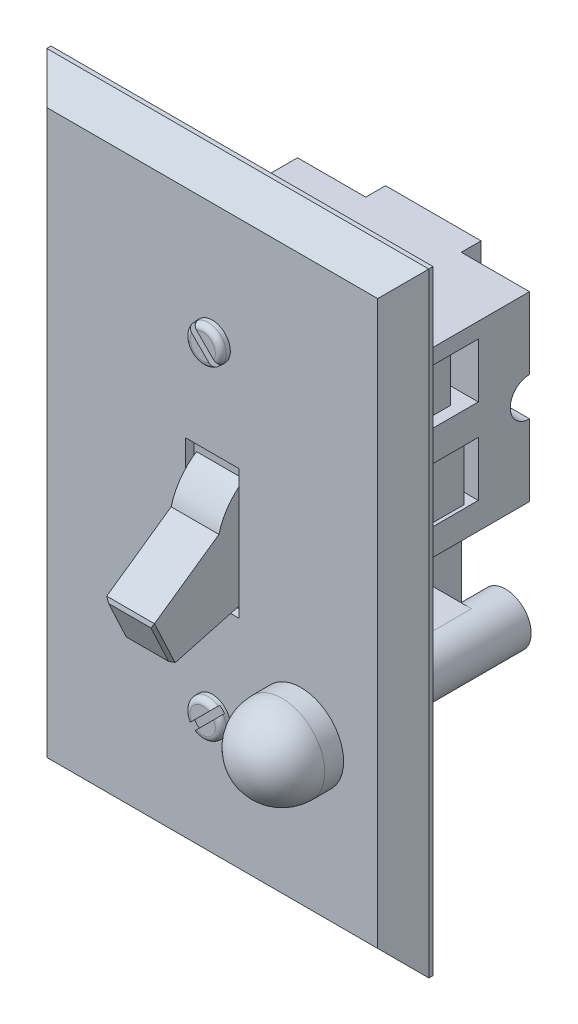
from build123d import *
from OCP.BRepFilletAPI import BRepFilletAPI_MakeChamfer

# Parameters (mm, degrees)
SKETCH1_W                 = 43.18
SKETCH1_H                 = 60.325
BOSS_EXTRUDE1_DEPTH       = 38.1
CUT_EXTRUDE1_DEPTH        = 54.174378287
CUT_EXTRUDE1_DEPTH_BACK   = 54.174378287
CUT_EXTRUDE2_DEPTH        = 12.7
CUT_EXTRUDE3_START        = -12.7
CUT_EXTRUDE3_DEPTH        = 12.7
CUT_EXTRUDE4_DEPTH        = 12.7
CUT_EXTRUDE5_DEPTH        = 15.875
CUT_EXTRUDE6_DEPTH        = 62.633906012
CUT_EXTRUDE6_DEPTH_BACK   = 62.633906012
SKETCH8_W                 = 3.81
SKETCH8_H                 = 2.8575
CUT_EXTRUDE7_DEPTH        = 44.241821553
SKETCH9_W                 = 12.7
SKETCH9_H                 = 14.478
CUT_EXTRUDE8_DEPTH        = 61.592610368
SKETCH10_W                = 12.7
SKETCH10_H                = 41.5925
CUT_EXTRUDE9_DEPTH        = 15.875
SKETCH11_W                = 3.175
SKETCH11_H                = 10.16
CUT_EXTRUDE10_DEPTH       = 12.7
SKETCH13_W                = 9.017
SKETCH13_H                = 10.16
SKETCH13_H_2              = 12.065
CUT_EXTRUDE11_DEPTH       = 2.032
CUT_EXTRUDE12_DEPTH       = 12.7
SKETCH15_R                = 2.413
BOSS_EXTRUDE2_DEPTH       = 1.524
SKETCH16_W                = 1.524
SKETCH16_H                = 9.906
BOSS_EXTRUDE3_DEPTH       = 6.858
SKETCH19_W                = 10.668
SKETCH19_H                = 13.589
BOSS_EXTRUDE5_DEPTH       = 1.524
SKETCH20_W                = 1.524
SKETCH20_H                = 12.065
BOSS_EXTRUDE6_DEPTH       = 6.858
SKETCH17_R                = 4.1275
BOSS_EXTRUDE4_DEPTH       = 2.54
FILLET1_R                 = 1.524
CUT_EXTRUDE13_DEPTH       = 1.27
CUT_EXTRUDE14_DEPTH       = 4.7625
CUT_EXTRUDE15_DEPTH       = 1.524
DELETEFACE2_START         = -8.89
DELETEFACE2_DEPTH         = 17.78
SKETCH23_R                = 1.7526
BOSS_EXTRUDE8_DEPTH       = 3.048
CUT_EXTRUDE16_DEPTH       = 70.14216971
CUT_EXTRUDE16_DEPTH_BACK  = 70.14216971
BOSS_EXTRUDE9_DEPTH       = 4.445
CHAMFER1_SIZE             = 0.508
CHAMFER1_SIZE2            = 0.62626395
BODY_MOVE_COPY1_ANGLE     = 25
BOSS_EXTRUDE10_DEPTH      = 1.524
BOSS_EXTRUDE10_DEPTH_BACK = 4.0259
SKETCH26_W                = 71.12
SKETCH26_H                = 114.3
CHAMFER2_SIZE             = 4.7625
SHELL1_T                  = -1.524
SKETCH27_R                = 6.731
SKETCH27_W                = 9.906
SKETCH27_H                = 24.13
CUT_EXTRUDE17_DEPTH       = 1.524
SKETCH28_R                = 3.3655
BOSS_EXTRUDE11_DEPTH      = 1.778
FILLET2_R                 = 1.016
CUT_EXTRUDE18_DEPTH       = 1.27
SKETCH31_R                = 4.7625
BOSS_EXTRUDE12_DEPTH      = 38.1
BOSS_EXTRUDE13_START      = -19.05
SKETCH32_W                = 7.62
SKETCH32_H                = 9.525
BOSS_EXTRUDE13_DEPTH      = 12.7


# Read off the part's stored shape, not the designer's step: DeleteFace2
with BuildPart() as part:
    # Sketch1 → Boss-Extrude1 (new body)
    with BuildSketch(Plane.XY):
        Rectangle(SKETCH1_W, SKETCH1_H)
    extrude(amount=BOSS_EXTRUDE1_DEPTH)

    # Sketch2 → Cut-Extrude1 (cut, two sides: drawn at the far end of the back side and taken through both)
    with BuildSketch(Plane(origin=(0, 0, 0), x_dir=(0, 0, -1), z_dir=(1, 0, 0)).offset(-CUT_EXTRUDE1_DEPTH_BACK)):
        Polygon((0, 0), (-3.683, -3.683), (-3.683, -30.1625), (0, -30.1625), align=None)
    extrude(amount=CUT_EXTRUDE1_DEPTH + CUT_EXTRUDE1_DEPTH_BACK, mode=Mode.SUBTRACT)

    # Sketch3 → Cut-Extrude2 (cut)
    with BuildSketch(Plane(origin=(21.59, 0, 0), x_dir=(0, 0, -1), z_dir=(1, 0, 0))):
        with BuildLine():
            Line((-3.683, 9.6647), (-3.683, -3.683))
            Line((-3.683, -3.683), (0, 0))
            Line((0, 0), (0, 30.1625))
            Line((0, 30.1625), (-3.683, 30.1625))
            Line((-3.683, 30.1625), (-3.683, 16.8148))
            ThreePointArc((-3.683, 16.8148), (-7.25805, 13.23975), (-3.683, 9.6647))
        make_face()
    extrude(amount=-CUT_EXTRUDE2_DEPTH, mode=Mode.SUBTRACT)

    # Sketch4 → Cut-Extrude3 (cut)
    with BuildSketch(Plane.ZY.offset(21.59).offset(CUT_EXTRUDE3_START)):
        with BuildLine():
            Line((3.683, -3.683), (3.683, 9.6647))
            ThreePointArc((3.683, 9.6647), (7.25805, 13.23975), (3.683, 16.8148))
            Line((3.683, 16.8148), (3.683, 30.1625))
            Line((3.683, 30.1625), (0, 30.1625))
            Line((0, 30.1625), (0, 0))
            Line((0, 0), (3.683, -3.683))
        make_face()
    extrude(amount=CUT_EXTRUDE3_DEPTH, mode=Mode.SUBTRACT)

    # Sketch5 → Cut-Extrude4 (cut)
    with BuildSketch(Plane(origin=(21.59, 0, 0), x_dir=(0, 0, -1), z_dir=(1, 0, 0))):
        with BuildLine():
            Line((-38.1, -13.208), (-26.9875, -13.208))
            ThreePointArc((-26.9875, -13.208), (-23.619903955, -11.813096045), (-22.225, -8.4455))
            Line((-22.225, -8.4455), (-22.225, -3.683))
            Line((-22.225, -3.683), (-3.683, -3.683))
            Line((-3.683, -3.683), (-3.683, -30.1625))
            Line((-3.683, -30.1625), (-38.1, -30.1625))
            Line((-38.1, -30.1625), (-38.1, -13.208))
        make_face()
    extrude(amount=-CUT_EXTRUDE4_DEPTH, mode=Mode.SUBTRACT)

    # Sketch6 → Cut-Extrude5 (cut)
    with BuildSketch(Plane.XY.offset(38.1)):
        with BuildLine():
            Line((13.97, 27.305), (21.59, 27.305))
            Line((21.59, 27.305), (21.59, 17.145))
            Line((21.59, 17.145), (13.97, 17.145))
            ThreePointArc((13.97, 17.145), (8.89, 22.225), (13.97, 27.305))
        make_face()
        with BuildLine():
            Line((13.97, 11.43), (21.59, 11.43))
            Line((21.59, 11.43), (21.59, 1.27))
            Line((21.59, 1.27), (13.97, 1.27))
            ThreePointArc((13.97, 1.27), (8.89, 6.35), (13.97, 11.43))
        make_face()
        with BuildLine():
            Line((-13.97, 1.27), (-21.59, 1.27))
            Line((-21.59, 1.27), (-21.59, 11.43))
            Line((-21.59, 11.43), (-13.97, 11.43))
            ThreePointArc((-13.97, 11.43), (-8.89, 6.35), (-13.97, 1.27))
        make_face()
        with BuildLine():
            Line((-13.97, 17.145), (-21.59, 17.145))
            Line((-21.59, 17.145), (-21.59, 27.305))
            Line((-21.59, 27.305), (-13.97, 27.305))
            ThreePointArc((-13.97, 27.305), (-8.89, 22.225), (-13.97, 17.145))
        make_face()
    extrude(amount=-CUT_EXTRUDE5_DEPTH, mode=Mode.SUBTRACT)

    # Sketch7 → Cut-Extrude6 (cut, two sides: drawn at the far end of the back side and taken through both)
    with BuildSketch(Plane.XZ.offset(13.208).offset(-CUT_EXTRUDE6_DEPTH_BACK)):
        with BuildLine():
            Line((14.605, 38.1), (14.605, 34.925))
            Line((14.605, 34.925), (17.78, 34.925))
            ThreePointArc((17.78, 34.925), (20.474076836, 33.809076836), (21.59, 31.115))
            Line((21.59, 31.115), (21.59, 38.1))
            Line((21.59, 38.1), (14.605, 38.1))
        make_face()
        with BuildLine():
            Line((-14.605, 34.925), (-17.78, 34.925))
            ThreePointArc((-17.78, 34.925), (-20.474076836, 33.809076836), (-21.59, 31.115))
            Line((-21.59, 31.115), (-21.59, 38.1))
            Line((-21.59, 38.1), (-14.605, 38.1))
            Line((-14.605, 38.1), (-14.605, 34.925))
        make_face()
    extrude(amount=CUT_EXTRUDE6_DEPTH + CUT_EXTRUDE6_DEPTH_BACK, mode=Mode.SUBTRACT)

    # Sketch8 → Cut-Extrude7 (cut, through all)
    with BuildSketch(Plane.XY.offset(22.225)):
        with Locations((-19.685, 28.73375)):
            Rectangle(SKETCH8_W, SKETCH8_H)
        with Locations((19.685, 28.73375)):
            Rectangle(SKETCH8_W, SKETCH8_H)
    extrude(amount=CUT_EXTRUDE7_DEPTH, mode=Mode.SUBTRACT)

    # Sketch9 → Cut-Extrude8 (cut, through all)
    with BuildSketch(Plane(origin=(14.605, 0, 0), x_dir=(0, 0, -1), z_dir=(1, 0, 0))):
        with Locations((-28.575, -5.969)):
            Rectangle(SKETCH9_W, SKETCH9_H)
    extrude(amount=CUT_EXTRUDE8_DEPTH, mode=Mode.SUBTRACT)

    # Sketch10 → Cut-Extrude9 (cut)
    with BuildSketch(Plane.XY.offset(38.1)):
        with Locations((-15.24, -9.36625)):
            Rectangle(SKETCH10_W, SKETCH10_H)
    extrude(amount=-CUT_EXTRUDE9_DEPTH, mode=Mode.SUBTRACT)

    # Sketch11 → Cut-Extrude10 (cut)
    with BuildSketch(Plane.ZY.offset(21.59)):
        with Locations((14.7955, 22.225)):
            Rectangle(SKETCH11_W, SKETCH11_H)
        with Locations((14.7955, 6.35)):
            Rectangle(SKETCH11_W, SKETCH11_H)
        with Locations((23.8125, 22.225)):
            Rectangle(SKETCH11_W, SKETCH11_H)
        with Locations((23.8125, 6.35)):
            Rectangle(SKETCH11_W, SKETCH11_H)
    cut_extrude10 = extrude(amount=-CUT_EXTRUDE10_DEPTH, mode=Mode.SUBTRACT)

    # Sketch13 → Cut-Extrude11 (cut)
    with BuildSketch(Plane.ZY.offset(21.59)):
        with Locations((20.8915, 22.225)):
            Rectangle(SKETCH13_W, SKETCH13_H)
        with Locations((20.8915, 6.35)):
            Rectangle(SKETCH13_W, SKETCH13_H)
        with Locations((17.7165, -24.13)):
            Rectangle(SKETCH13_W, SKETCH13_H_2)
    cut_extrude11 = extrude(amount=-CUT_EXTRUDE11_DEPTH, mode=Mode.SUBTRACT)

    # Sketch14 → Cut-Extrude12 (cut)
    with BuildSketch(Plane.ZY.offset(21.59)):
        Polygon((22.225, -1.27), (13.208, -1.27), (13.208, -15.5575), (16.383, -15.5575), (17.145, -10.16), (22.225, -10.16), align=None)
    extrude(amount=-CUT_EXTRUDE12_DEPTH, mode=Mode.SUBTRACT)

    # Sketch15 → Boss-Extrude2 (add)
    with BuildSketch(Plane.XY.offset(22.225)):
        with BuildLine():
            Line((-15.24, 1.397), (-21.082, 1.397))
            Line((-21.082, 1.397), (-21.082, 11.303))
            Line((-21.082, 11.303), (-15.24, 11.303))
            ThreePointArc((-15.24, 11.303), (-10.287, 6.35), (-15.24, 1.397))
        make_face()
        with Locations((-15.24, 6.35)):
            Circle(SKETCH15_R, mode=Mode.SUBTRACT)
    boss_extrude2 = extrude(amount=BOSS_EXTRUDE2_DEPTH)

    # Sketch16 → Boss-Extrude3 (add)
    with BuildSketch(Plane(origin=(0, 0, 22.225), x_dir=(-1, 0, 0), z_dir=(0, 0, -1))):
        with Locations((20.32, 6.35)):
            Rectangle(SKETCH16_W, SKETCH16_H)
    boss_extrude3 = extrude(amount=BOSS_EXTRUDE3_DEPTH)

    # Mirror1: Cut-Extrude10, Cut-Extrude11, Boss-Extrude2, Boss-Extrude3 across plane
    add(cut_extrude10.mirror(Plane(origin=(0, 0, 0), x_dir=(0, 0, 1), z_dir=(1, 0, 0))), mode=Mode.SUBTRACT)
    add(cut_extrude11.mirror(Plane(origin=(0, 0, 0), x_dir=(0, 0, 1), z_dir=(1, 0, 0))), mode=Mode.SUBTRACT)
    add(boss_extrude2.mirror(Plane(origin=(0, 0, 0), x_dir=(0, 0, 1), z_dir=(1, 0, 0))))
    add(boss_extrude3.mirror(Plane(origin=(0, 0, 0), x_dir=(0, 0, 1), z_dir=(1, 0, 0))))

    # Sketch19 → Boss-Extrude5 (add)
    with BuildSketch(Plane.XY.offset(22.225)):
        with Locations((-15.748, -23.368)):
            Rectangle(SKETCH19_W, SKETCH19_H)
    extrude(amount=BOSS_EXTRUDE5_DEPTH)

    # Sketch20 → Boss-Extrude6 (add)
    with BuildSketch(Plane(origin=(0, 0, 22.225), x_dir=(-1, 0, 0), z_dir=(0, 0, -1))):
        with Locations((20.32, -24.13)):
            Rectangle(SKETCH20_W, SKETCH20_H)
    extrude(amount=BOSS_EXTRUDE6_DEPTH)

    # Sketch17 → Boss-Extrude4 (add)
    with BuildSketch(Plane.XY.offset(23.749)):
        with Locations((15.24, 6.35)):
            Circle(SKETCH17_R)
        with Locations((-15.748, -25.4635)):
            Circle(SKETCH17_R)
    extrude(amount=BOSS_EXTRUDE4_DEPTH)

    # Fillet1
    fillet1_edges = [part.edges().sort_by_distance(p)[0] for p in [
        (11.1125, 6.35, 26.289),
        (-19.8755, -25.4635, 26.289),
    ]]
    fillet(fillet1_edges, radius=FILLET1_R)

    # Sketch18 → Cut-Extrude13 (cut)
    with BuildSketch(Plane.XY.offset(26.289)):
        Polygon((11.872403955, 8.819570433), (12.770429567, 9.717596045), (18.607596045, 3.880429567), (17.709570433, 2.982403955), align=None)
        Polygon((-18.217570433, -22.095903955), (-19.115596045, -22.993929567), (-13.278429567, -28.831096045), (-12.380403955, -27.933070433), align=None)
    extrude(amount=-CUT_EXTRUDE13_DEPTH, mode=Mode.SUBTRACT)

    # Sketch21 → Cut-Extrude14 (cut, symmetric)
    with BuildSketch(Plane(origin=(0, 0, 0), x_dir=(0, 0, -1), z_dir=(1, 0, 0))):
        Polygon((-38.1, 30.1625), (-38.1, 10.16), (-36.576, 11.03988181), (-36.576, 30.1625), align=None)
        Polygon((-36.576, -30.1625), (-38.1, -30.1625), (-38.1, -10.16), (-36.576, -11.03988181), align=None)
    extrude(amount=CUT_EXTRUDE14_DEPTH, both=True, mode=Mode.SUBTRACT)

    # Sketch22 → Cut-Extrude15 (cut)
    with BuildSketch(Plane.XY.offset(38.1)):
        Polygon((-4.7625, -20.6375), (-8.89, -16.51), (-8.89, -11.03988181), (8.89, -11.03988181), (8.89, -16.51), (4.7625, -20.6375), align=None)
        Polygon((8.89, 16.51), (4.7625, 20.6375), (-4.7625, 20.6375), (-8.89, 16.51), (-8.89, 11.03988181), (8.89, 11.03988181), align=None)
    extrude(amount=-CUT_EXTRUDE15_DEPTH, mode=Mode.SUBTRACT)

    # DeleteFace2 outline → DeleteFace2 (cut)
    with BuildSketch(Plane.YZ.offset(DELETEFACE2_START)):
        Polygon((11.03988181, 38.1), (10.16, 38.1), (11.03988181, 36.576), align=None)
        Polygon((-11.03988181, 36.576), (-10.16, 38.1), (-11.03988181, 38.1), align=None)
    extrude(amount=DELETEFACE2_DEPTH, mode=Mode.SUBTRACT)



with BuildPart() as body_2:
    # Sketch23 → Boss-Extrude8 (new body)
    with BuildSketch(Plane.XY.offset(36.576)):
        with BuildLine():
            Line((-6.35, -52.3875), (-19.05, -52.3875))
            Line((-19.05, -52.3875), (-19.05, -47.8155))
            Line((-19.05, -47.8155), (-14.2875, -47.8155))
            ThreePointArc((-14.2875, -47.8155), (-12.5095, -46.0375), (-14.2875, -44.2595))
            Line((-14.2875, -44.2595), (-19.05, -44.2595))
            Line((-19.05, -44.2595), (-19.05, -39.6875))
            Line((-19.05, -39.6875), (-7.31887382, -39.6875))
            Line((-7.31887382, -39.6875), (-4.5085, -34.819789755))
            Line((-4.5085, -34.819789755), (-4.5085, -20.532289755))
            Line((-4.5085, -20.532289755), (-8.636, -16.404789755))
            Line((-8.636, -16.404789755), (-8.636, 16.404789755))
            Line((-8.636, 16.404789755), (-4.5085, 20.532289755))
            Line((-4.5085, 20.532289755), (-4.5085, 34.819789755))
            Line((-4.5085, 34.819789755), (-7.31887382, 39.6875))
            Line((-7.31887382, 39.6875), (-19.05, 39.6875))
            Line((-19.05, 39.6875), (-19.05, 44.2595))
            Line((-19.05, 44.2595), (-14.2875, 44.2595))
            ThreePointArc((-14.2875, 44.2595), (-12.5095, 46.0375), (-14.2875, 47.8155))
            Line((-14.2875, 47.8155), (-19.05, 47.8155))
            Line((-19.05, 47.8155), (-19.05, 52.3875))
            Line((-19.05, 52.3875), (-6.35, 52.3875))
            Line((-6.35, 52.3875), (-6.35, 46.0375))
            Line((-6.35, 46.0375), (6.35, 46.0375))
            Line((6.35, 46.0375), (6.35, 52.3875))
            Line((6.35, 52.3875), (19.05, 52.3875))
            Line((19.05, 52.3875), (19.05, 47.8155))
            Line((19.05, 47.8155), (14.2875, 47.8155))
            ThreePointArc((14.2875, 47.8155), (12.5095, 46.0375), (14.2875, 44.2595))
            Line((14.2875, 44.2595), (19.05, 44.2595))
            Line((19.05, 44.2595), (19.05, 39.6875))
            Line((19.05, 39.6875), (7.31887382, 39.6875))
            Line((7.31887382, 39.6875), (4.5085, 34.819789755))
            Line((4.5085, 34.819789755), (4.5085, 20.532289755))
            Line((4.5085, 20.532289755), (8.636, 16.404789755))
            Line((8.636, 16.404789755), (8.636, -16.404789755))
            Line((8.636, -16.404789755), (4.5085, -20.532289755))
            Line((4.5085, -20.532289755), (4.5085, -34.819789755))
            Line((4.5085, -34.819789755), (7.31887382, -39.6875))
            Line((7.31887382, -39.6875), (19.05, -39.6875))
            Line((19.05, -39.6875), (19.05, -44.2595))
            Line((19.05, -44.2595), (14.2875, -44.2595))
            ThreePointArc((14.2875, -44.2595), (12.5095, -46.0375), (14.2875, -47.8155))
            Line((14.2875, -47.8155), (19.05, -47.8155))
            Line((19.05, -47.8155), (19.05, -52.3875))
            Line((19.05, -52.3875), (6.35, -52.3875))
            Line((6.35, -52.3875), (6.35, -46.0375))
            Line((6.35, -46.0375), (-6.35, -46.0375))
            Line((-6.35, -46.0375), (-6.35, -52.3875))
        make_face()
        with Locations((0, 30.1625)):
            Circle(SKETCH23_R, mode=Mode.SUBTRACT)
        with Locations(Location((0, -30.1625, 0), (0, 0, 180))):
            Circle(SKETCH23_R, mode=Mode.SUBTRACT)
    extrude(amount=BOSS_EXTRUDE8_DEPTH)

    # Sketch24 → Cut-Extrude16 (cut, two sides: drawn at the far end of the back side and taken through both)
    with BuildSketch(Plane(origin=(0, 0, 0), x_dir=(0, 0, -1), z_dir=(1, 0, 0)).offset(-CUT_EXTRUDE16_DEPTH_BACK)):
        Polygon((-38.1, 52.3875), (-38.1, 39.6875), (-36.576, 34.819789755), (-36.576, 52.3875), align=None)
        Polygon((-39.624, 39.6875), (-38.1, 34.819789755), (-38.1, 11.91976362), (-39.624, 11.03988181), align=None)
        Polygon((-39.624, -11.03988181), (-39.624, -39.6875), (-38.1, -34.819789755), (-38.1, -11.91976362), align=None)
        Polygon((-36.576, -52.3875), (-38.1, -52.3875), (-38.1, -39.6875), (-36.576, -34.819789755), align=None)
    extrude(amount=CUT_EXTRUDE16_DEPTH + CUT_EXTRUDE16_DEPTH_BACK, mode=Mode.SUBTRACT)


with BuildPart() as body_3:
    # Sketch25 → Boss-Extrude9 (new, symmetric)
    with BuildSketch(Plane(origin=(0, 0, 0), x_dir=(0, 0, -1), z_dir=(1, 0, 0))):
        with BuildLine():
            Line((-42.164, 7.07623937), (-57.0865, 4.445))
            Line((-57.0865, 4.445), (-57.0865, -4.445))
            Line((-57.0865, -4.445), (-42.164, -7.07623937))
            ThreePointArc((-42.164, -7.07623937), (-38.331433978, -10.052919134), (-33.595774242, -11.1125))
            Line((-33.595774242, -11.1125), (-33.595774242, 11.1125))
            ThreePointArc((-33.595774242, 11.1125), (-38.331433978, 10.052919134), (-42.164, 7.07623937))
        make_face()
    extrude(amount=BOSS_EXTRUDE9_DEPTH, both=True)

    # Chamfer1: one chamfer whose edges measure the first distance from different faces: ONE call of the kernel's chamfer builder (chamfer() names one face for all edges)
    chamfer1_edges_1 = [body_3.edges().sort_by_distance(p)[0] for p in [
        (0, 4.445, 57.0865),
    ]]
    chamfer1_side_1 = [body_3.faces().sort_by_distance(p)[0] for p in [
        (0, 5.760619685, 49.62525),
    ]]
    chamfer1_edges_2 = [body_3.edges().sort_by_distance(p)[0] for p in [
        (0, -4.445, 57.0865),
    ]]
    chamfer1_side_2 = [body_3.faces().sort_by_distance(p)[0] for p in [
        (0, 0, 57.0865),
    ]]
    chamfer1_edges_3 = [body_3.edges().sort_by_distance(p)[0] for p in [
        (4.445, 0, 57.0865),
        (-4.445, 0, 57.0865),
    ]]
    chamfer1 = BRepFilletAPI_MakeChamfer(body_3.part.solid().wrapped)
    for e in chamfer1_edges_1:
        chamfer1.Add(CHAMFER1_SIZE, CHAMFER1_SIZE2, e.wrapped, chamfer1_side_1[0].wrapped)  # the first distance lies on this face
    for e in chamfer1_edges_2:
        chamfer1.Add(CHAMFER1_SIZE, CHAMFER1_SIZE2, e.wrapped, chamfer1_side_2[0].wrapped)  # the first distance lies on this face
    for e in chamfer1_edges_3:
        chamfer1.Add(CHAMFER1_SIZE, e.wrapped)
    add(Compound.cast(chamfer1.Shape()), mode=Mode.REPLACE)


with BuildPart() as body_3_1:
    # Body-Move/Copy1: moved
    add(body_3.part.rotate(Axis((0, 0, 33.595774242), (1, 0, 0)), BODY_MOVE_COPY1_ANGLE))


with BuildPart() as body_4:
    # Sketch26 → Boss-Extrude10 (new, two sides: drawn at the far end of the back side and taken through both)
    with BuildSketch(Plane.XY.offset(39.624).offset(-BOSS_EXTRUDE10_DEPTH_BACK)):
        Rectangle(SKETCH26_W, SKETCH26_H)
    extrude(amount=BOSS_EXTRUDE10_DEPTH + BOSS_EXTRUDE10_DEPTH_BACK)

    # Chamfer2
    chamfer2_edges = [body_4.edges().sort_by_distance(p)[0] for p in [
        (-35.56, 0, 41.148),
        (0, -57.15, 41.148),
        (35.56, 0, 41.148),
        (0, 57.15, 41.148),
    ]]
    chamfer(chamfer2_edges, length=CHAMFER2_SIZE)

    # Shell1
    shell1_openings = [body_4.faces().sort_by_distance(p)[0] for p in [
        (0, 0, 35.5981),
    ]]
    offset(amount=SHELL1_T, openings=shell1_openings, kind=Kind.INTERSECTION)

    # Sketch27 → Cut-Extrude17 (cut)
    with BuildSketch(Plane.XY.offset(41.148)):
        with Locations((16.51, -25.4)):
            Circle(SKETCH27_R)
        Rectangle(SKETCH27_W, SKETCH27_H)
    extrude(amount=-CUT_EXTRUDE17_DEPTH, mode=Mode.SUBTRACT)

    # Sketch28 → Boss-Extrude11 (add)
    with BuildSketch(Plane.XY.offset(41.148)):
        with Locations((0, 30.1625)):
            Circle(SKETCH28_R)
        with Locations((0, -30.1625)):
            Circle(SKETCH28_R)
    extrude(amount=BOSS_EXTRUDE11_DEPTH)

    # Fillet2
    fillet2_edges = [body_4.edges().sort_by_distance(p)[0] for p in [
        (-3.3655, 30.1625, 42.926),
        (-3.3655, -30.1625, 42.926),
    ]]
    fillet(fillet2_edges, radius=FILLET2_R)

    # Sketch29 → Cut-Extrude18 (cut)
    with BuildSketch(Plane.XY.offset(42.926)):
        Polygon((-1.930755066, 32.991280678), (-2.828780678, 32.093255066), (1.930755066, 27.333719322), (2.828780678, 28.231744934), align=None)
        Polygon((2.828780678, -28.231744934), (1.930755066, -27.333719322), (-2.828780678, -32.093255066), (-1.930755066, -32.991280678), align=None)
    extrude(amount=-CUT_EXTRUDE18_DEPTH, mode=Mode.SUBTRACT)

    # Sketch30 → Revolve1 (revolve)
    with BuildSketch(Plane(origin=(16.51, 0, 0), x_dir=(0, 0, -1), z_dir=(1, 0, 0)), mode=Mode.PRIVATE) as revolve1_sk:
        with BuildLine():
            Line((-41.148, -17.4625), (-44.6405, -17.4625))
            ThreePointArc((-44.6405, -17.4625), (-50.253160076, -19.787339924), (-52.578, -25.4))
            Line((-52.578, -25.4), (-41.148, -25.4))
            Line((-41.148, -25.4), (-41.148, -17.4625))
        make_face()
    revolve(revolve1_sk.sketch.rotate(Axis((16.51, -25.4, 52.578), (0, 0, -1)), 90), axis=Axis((16.51, -25.4, 52.578), (0, 0, -1)))


with BuildPart() as part_1:
    add(part.part)

    add(body_2.part)  # Boss-Extrude12 merges body 2

    add(body_4.part)  # Boss-Extrude12 merges body 4
    # Sketch31 → Boss-Extrude12 (add)
    with BuildSketch(Plane(origin=(0, 0, 41.148), x_dir=(-1, 0, 0), z_dir=(0, 0, -1))):
        with Locations(Location((-16.51, -25.4, 0), (0, 0, 180))):
            Circle(SKETCH31_R)
    extrude(amount=BOSS_EXTRUDE12_DEPTH)

    # Sketch32 → Boss-Extrude13 (add, symmetric)
    with BuildSketch(Plane(origin=(0, 0, 3.048), x_dir=(-1, 0, 0), z_dir=(0, 0, -1)).offset(BOSS_EXTRUDE13_START)):
        with Locations((-12.7, -25.4)):
            Rectangle(SKETCH32_W, SKETCH32_H)
    extrude(amount=BOSS_EXTRUDE13_DEPTH, both=True)


solid = Compound([body_3_1.part, part_1.part])
